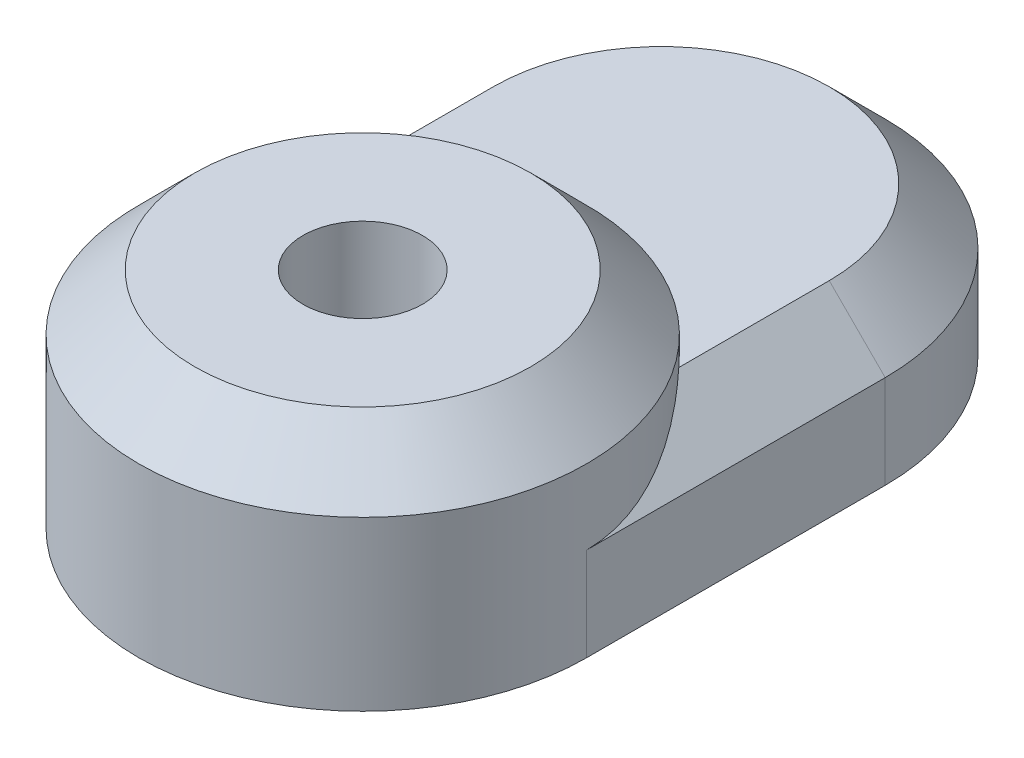
from build123d import *

# Parameters (mm, degrees)
SKETCH1_R           = 1.6
BOSS_EXTRUDE1_DEPTH = 4
SKETCH2_R           = 6
SKETCH2_R_2         = 1.6
BOSS_EXTRUDE2_DEPTH = 2
CHAMFER1_SIZE       = 1.5


with BuildPart() as part:
    # Sketch1 → Boss-Extrude1 (new body)
    with BuildSketch(Plane(origin=(0, 0, 0), x_dir=(1, 0, 0), z_dir=(0, 1, 0))):
        with BuildLine():
            Line((-6, 0), (-6, 8))
            ThreePointArc((-6, 8), (0, 14), (6, 8))
            Line((6, 8), (6, 0))
            ThreePointArc((6, 0), (0, -6), (-6, 0))
        make_face()
        with Locations(Location((0, 0, 0), (0, 0, 270))):
            Circle(SKETCH1_R, mode=Mode.SUBTRACT)
    extrude(amount=BOSS_EXTRUDE1_DEPTH)

    # Sketch2 → Boss-Extrude2 (add)
    with BuildSketch(Plane(origin=(0, 4, 0), x_dir=(1, 0, 0), z_dir=(0, 1, 0))):
        Circle(SKETCH2_R)
        with Locations(Location((0, 0, 0), (0, 0, 270))):
            Circle(SKETCH2_R_2, mode=Mode.SUBTRACT)
    extrude(amount=BOSS_EXTRUDE2_DEPTH)

    # Chamfer1
    # the kernel refuses this chamfer: 1.5 mm, written as the material it takes off along each edge
    with BuildSketch(Plane(origin=(0, 6, 0), x_dir=(1, 0, 0), z_dir=(0, 0, 1))) as chamfer1_piece_1:
        Polygon((6, -CHAMFER1_SIZE), (6 - CHAMFER1_SIZE, 0), (6, 0), align=None)
    revolve(axis=Axis((0, 6, 0), (0, 1, 0)), mode=Mode.SUBTRACT)
    with BuildSketch(Plane(origin=(6, 4, -8), x_dir=(0.0274958766105862, -0.9996219169112968, 0), z_dir=(0, 0, 1))) as chamfer1_piece_2_section:
        Polygon((CHAMFER1_SIZE * 0.999621916911, -CHAMFER1_SIZE * 0.0274958766106), (-CHAMFER1_SIZE * 0.0274958766106, -CHAMFER1_SIZE * 0.999621916911), (0, 0), align=None)
    chamfer1_piece_2 = extrude(amount=11.857524482, mode=Mode.PRIVATE)
    chamfer1_piece_2 = chamfer1_piece_2 - Plane(origin=(0, 3.415911746, 0), x_dir=(1, 0, 0), z_dir=(0, -1, 0)) * Cylinder(6, 30, mode=Mode.PRIVATE)
    add(chamfer1_piece_2, mode=Mode.SUBTRACT)
    with BuildSketch(Plane(origin=(0, 4, -8), x_dir=(-1, 0, 0), z_dir=(0, 0, 1))) as chamfer1_piece_3:
        Polygon((6, CHAMFER1_SIZE), (6 - CHAMFER1_SIZE, 0), (6, 0), align=None)
    revolve(axis=Axis((0, 4, -8), (0, -1, 0)), revolution_arc=180, mode=Mode.SUBTRACT)
    with BuildSketch(Plane(origin=(-6, 4, 3.857524482), x_dir=(0.9996219169112969, 0.02749587661058621, 0), z_dir=(0, 0, -1))) as chamfer1_piece_4_section:
        Polygon((CHAMFER1_SIZE * 0.999621916911, CHAMFER1_SIZE * 0.0274958766106), (-CHAMFER1_SIZE * 0.0274958766106, CHAMFER1_SIZE * 0.999621916911), (0, 0), align=None)
    chamfer1_piece_4 = extrude(amount=11.857524482, mode=Mode.PRIVATE)
    chamfer1_piece_4 = chamfer1_piece_4 - Plane(origin=(0, 3.415911747, 0), x_dir=(1, 0, 0), z_dir=(0, -1, 0)) * Cylinder(6, 30, mode=Mode.PRIVATE)
    add(chamfer1_piece_4, mode=Mode.SUBTRACT)


solid = part.part
